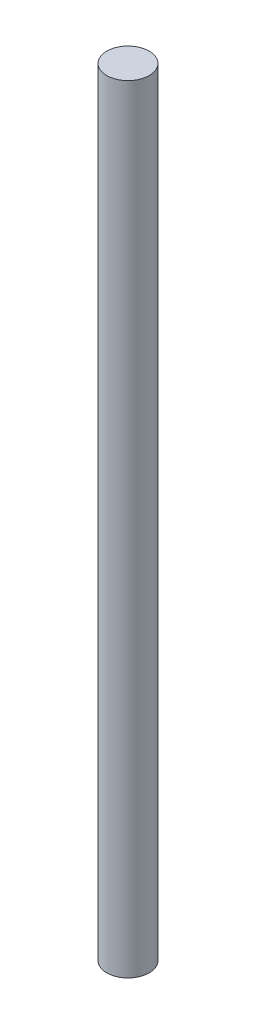
from build123d import *

# Parameters (mm, degrees)
SKETCH1_R           = 1.4732
BOSS_EXTRUDE1_DEPTH = 53.975


with BuildPart() as part:
    # Sketch1 → Boss-Extrude1 (new body)
    with BuildSketch(Plane(origin=(0, 0, 0), x_dir=(1, 0, 0), z_dir=(0, 1, 0))):
        Circle(SKETCH1_R)
    extrude(amount=BOSS_EXTRUDE1_DEPTH)


solid = part.part
